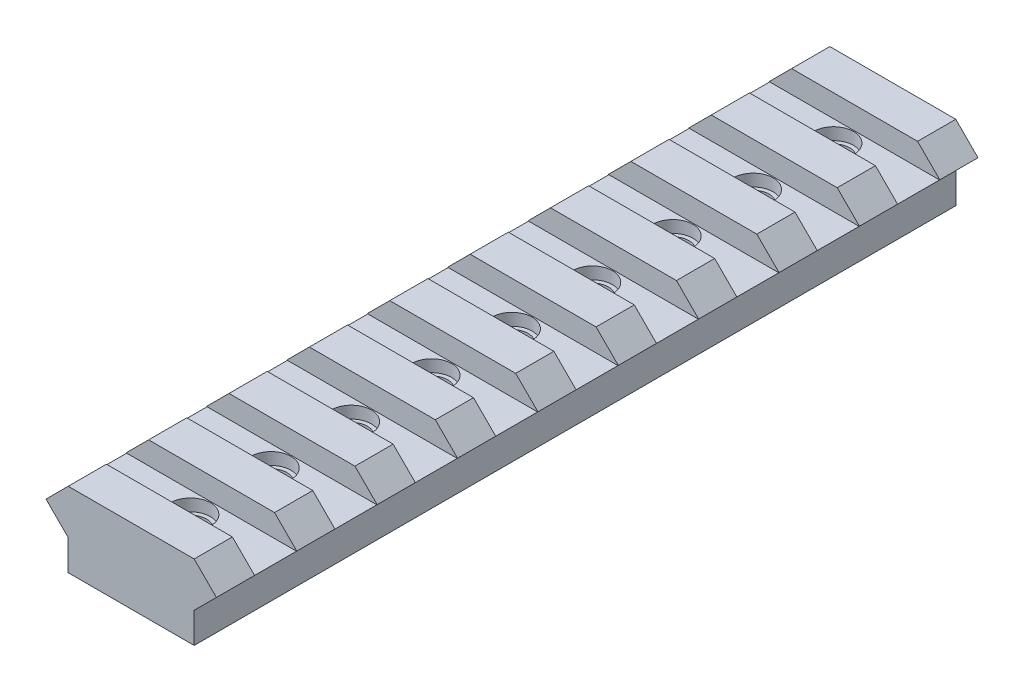
from build123d import *

# Parameters (mm, degrees)
DODANIE_WYCI_GNI_CIE2_DEPTH = 94.75
SZKIC2_W                    = 21.199999292
SZKIC2_H                    = 5.25
WYTNIJ_WYCI_GNI_CIE2_DEPTH  = 2.8
SZKIC3_R                    = 2
WYTNIJ_WYCI_GNI_CIE3_DEPTH  = 6.52
SZKIC4_R                    = 2.5
WYTNIJ_WYCI_GNI_CIE4_DEPTH  = 1.5


with BuildPart() as part:
    # Szkic1 → Dodanie-wyciągnięcie2 (new body)
    with BuildSketch(Plane.XY):
        Polygon((-7.835, 4.66), (-10.599999646, 1.895000354), (-7.835, -0.869999293), (-7.835, -4.66), (7.835, -4.66), (7.835, -0.869999293), (10.599999646, 1.895000354), (7.835, 4.66), align=None)
    extrude(amount=DODANIE_WYCI_GNI_CIE2_DEPTH)

    # Szkic2 → Wytnij-wyciągnięcie2 (cut)
    with BuildSketch(Plane(origin=(0, 4.66, 0), x_dir=(1, 0, 0), z_dir=(0, 1, 0))):
        with Locations((0, -17.375)):
            Rectangle(SZKIC2_W, SZKIC2_H)
        with Locations((0, -7.375)):
            Rectangle(SZKIC2_W, SZKIC2_H)
        with Locations((0, -27.375)):
            Rectangle(SZKIC2_W, SZKIC2_H)
        with Locations((0, -37.375)):
            Rectangle(SZKIC2_W, SZKIC2_H)
        with Locations((0, -47.375)):
            Rectangle(SZKIC2_W, SZKIC2_H)
        with Locations((0, -57.375)):
            Rectangle(SZKIC2_W, SZKIC2_H)
        with Locations((0, -67.375)):
            Rectangle(SZKIC2_W, SZKIC2_H)
        with Locations((0, -77.375)):
            Rectangle(SZKIC2_W, SZKIC2_H)
        with Locations((0, -87.375)):
            Rectangle(SZKIC2_W, SZKIC2_H)
    extrude(amount=-WYTNIJ_WYCI_GNI_CIE2_DEPTH, mode=Mode.SUBTRACT)

    # Szkic3 → Wytnij-wyciągnięcie3 (cut)
    with BuildSketch(Plane(origin=(0, 1.86, 0), x_dir=(1, 0, 0), z_dir=(0, 1, 0))):
        with Locations((0, -7.375)):
            Circle(SZKIC3_R)
        with Locations((0, -17.375)):
            Circle(SZKIC3_R)
        with Locations((0, -27.375)):
            Circle(SZKIC3_R)
        with Locations((0, -37.375)):
            Circle(SZKIC3_R)
        with Locations((0, -47.375)):
            Circle(SZKIC3_R)
        with Locations((0, -57.375)):
            Circle(SZKIC3_R)
        with Locations((0, -67.375)):
            Circle(SZKIC3_R)
        with Locations((0, -77.375)):
            Circle(SZKIC3_R)
        with Locations((0, -87.375)):
            Circle(SZKIC3_R)
    extrude(amount=-WYTNIJ_WYCI_GNI_CIE3_DEPTH, mode=Mode.SUBTRACT)

    # Szkic4 → Wytnij-wyciągnięcie4 (cut)
    with BuildSketch(Plane(origin=(0, 1.86, -1.86), x_dir=(1, 0, 0), z_dir=(0, -1, 0))):
        with Locations((0, 89.235)):
            Circle(SZKIC4_R)
        with Locations((0, 79.235)):
            Circle(SZKIC4_R)
        with Locations((0, 69.235)):
            Circle(SZKIC4_R)
        with Locations((0, 59.235)):
            Circle(SZKIC4_R)
        with Locations((0, 49.235)):
            Circle(SZKIC4_R)
        with Locations((0, 39.235)):
            Circle(SZKIC4_R)
        with Locations((0, 29.235)):
            Circle(SZKIC4_R)
        with Locations((0, 19.235)):
            Circle(SZKIC4_R)
        with Locations((0, 9.235)):
            Circle(SZKIC4_R)
    extrude(amount=WYTNIJ_WYCI_GNI_CIE4_DEPTH, mode=Mode.SUBTRACT)


solid = part.part
